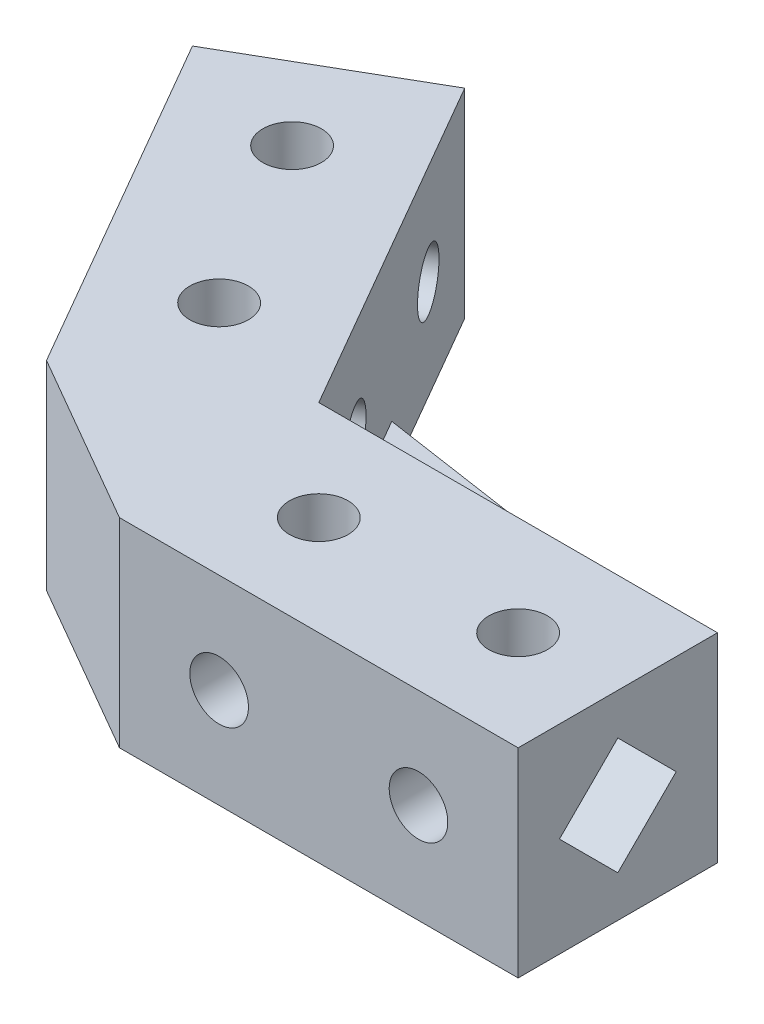
from build123d import *

# Parameters (mm, degrees)
SKETCH1_W           = 34
SKETCH1_H           = 17
SKETCH1_R           = 2.5
BOSS_EXTRUDE1_DEPTH = 17
SKETCH6_OUTSIDE_W   = 44.328
SKETCH6_OUTSIDE_H   = 27.328
SKETCH6_OUTSIDE_W_2 = 34
SKETCH6_OUTSIDE_H_2 = 17
SKETCH6_OUTSIDE_R   = 2.5
CUT_EXTRUDE10_DEPTH = 42.641325627
SKETCH7_OUTSIDE_W   = 27.328
SKETCH7_OUTSIDE_H   = 27.328
SKETCH7_OUTSIDE_W_2 = 17
SKETCH7_OUTSIDE_H_2 = 17
CUT_EXTRUDE11_DEPTH = 17
BOSS_EXTRUDE2_DEPTH = 17
SKETCH13_R          = 2.5
BOSS_EXTRUDE3_DEPTH = 4


with BuildPart() as part:
    # sketch1 → Boss-Extrude1 (new body)
    with BuildSketch(Plane(origin=(0, 0, 0), x_dir=(1, 0, 0), z_dir=(0, 1, 0))):
        with Locations((17, -8.5)):
            Rectangle(SKETCH1_W, SKETCH1_H)
        with Locations((8.5, -8.5)):
            Circle(SKETCH1_R, mode=Mode.SUBTRACT)
        with Locations((25.5, -8.5)):
            Circle(SKETCH1_R, mode=Mode.SUBTRACT)
    extrude(amount=BOSS_EXTRUDE1_DEPTH)

    # Sketch6 outside → Cut-Extrude10 (cut, through all)
    # profile 1 of 3: a face of its own
    with BuildSketch(Plane(origin=(0, 0, 0), x_dir=(-1, 0, 0), z_dir=(0, 0, -1))):
        with Locations((-17, 8.5)):
            Rectangle(SKETCH6_OUTSIDE_W, SKETCH6_OUTSIDE_H)
        with Locations((-17, 8.5)):
            Rectangle(SKETCH6_OUTSIDE_W_2, SKETCH6_OUTSIDE_H_2, mode=Mode.SUBTRACT)
    # profile 2 of 3: a face of its own
    with BuildSketch(Plane(origin=(0, 0, 0), x_dir=(-1, 0, 0), z_dir=(0, 0, -1))):
        with Locations((-25.5, 8.5)):
            Circle(SKETCH6_OUTSIDE_R)
    # profile 3 of 3: a face of its own
    with BuildSketch(Plane(origin=(0, 0, 0), x_dir=(-1, 0, 0), z_dir=(0, 0, -1))):
        with Locations((-8.5, 8.5)):
            Circle(SKETCH6_OUTSIDE_R)
    extrude(amount=-CUT_EXTRUDE10_DEPTH, mode=Mode.SUBTRACT)

    # Sketch7 outside → Cut-Extrude11 (cut)
    # profile 1 of 2: a face of its own
    with BuildSketch(Plane(origin=(34, 0, 0), x_dir=(0, 0, -1), z_dir=(1, 0, 0))):
        with Locations((-8.5, 8.5)):
            Rectangle(SKETCH7_OUTSIDE_W, SKETCH7_OUTSIDE_H)
        with Locations((-8.5, 8.5)):
            Rectangle(SKETCH7_OUTSIDE_W_2, SKETCH7_OUTSIDE_H_2, mode=Mode.SUBTRACT)
    # profile 2 of 2: a face of its own
    with BuildSketch(Plane(origin=(34, 0, 0), x_dir=(0, 0, -1), z_dir=(1, 0, 0))):
        Polygon((-8.5, 13.47803174), (-3.52196826, 8.5), (-8.5, 3.52196826), (-13.47803174, 8.5), align=None)
    extrude(amount=-CUT_EXTRUDE11_DEPTH, mode=Mode.SUBTRACT)


with BuildPart() as body_2:
    # Mirror6: mirrored copy
    add(part.part.mirror(Plane(origin=(0, 0, 0), x_dir=(-0.4999999999999979, 0, 0.8660254037844398), z_dir=(-0.8660254037844399, 0, -0.4999999999999979))))


with BuildPart() as part_1:
    add(part.part)

    add(body_2.part)  # Boss-Extrude2 merges body 2
    # Sketch11 → Boss-Extrude2 (add)
    with BuildSketch(Plane(origin=(0, 0, 0), x_dir=(1, 0, 0), z_dir=(0, 1, 0))):
        Polygon((-14.722431864, -8.5), (0, -17), (0, 0), align=None)
    extrude(amount=BOSS_EXTRUDE2_DEPTH)

    # Sketch13 → Boss-Extrude3 (add)
    with BuildSketch(Plane(origin=(0, 0, 0), x_dir=(1, 0, 0), z_dir=(0, 1, 0))):
        Polygon((7.152847248, 12.389094852), (-8.5, 14.722431864), (0, 0), (17, 0), align=None)
        with Locations((4.652847248, 8.058967833)):
            Circle(SKETCH13_R, mode=Mode.SUBTRACT)
    extrude(amount=BOSS_EXTRUDE3_DEPTH)


solid = part_1.part
